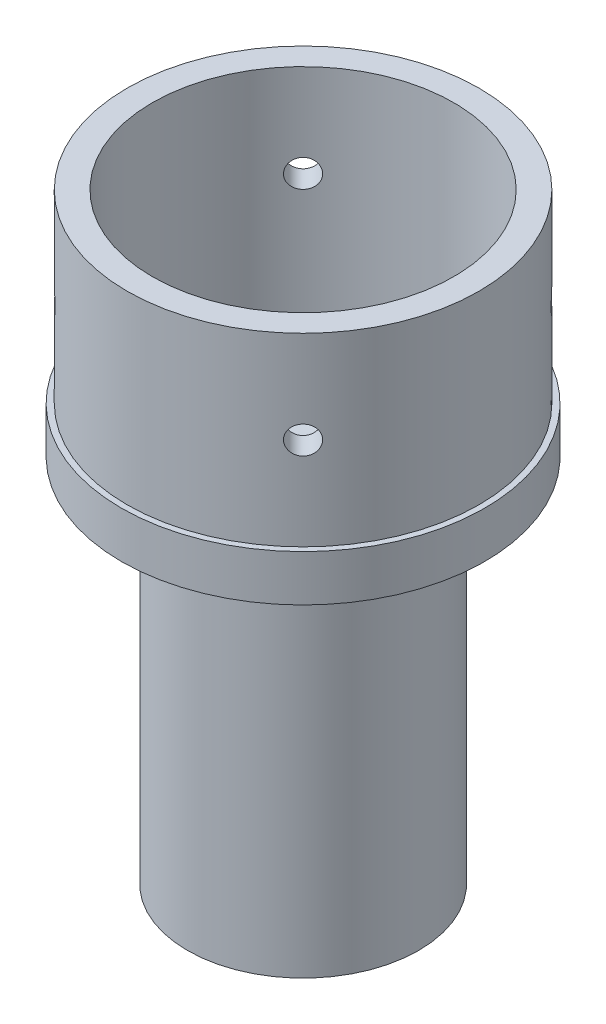
from build123d import *

# Parameters (mm, degrees)
SKETCH2_R                 = 25
SKETCH2_R_2               = 19
BOSS_EXTRUDE1_DEPTH       = 70
BOSS_EXTRUDE2_START       = 10
SKETCH3_R                 = 38.05
SKETCH3_R_2               = 32.6
BOSS_EXTRUDE2_DEPTH       = 50
BOSS_EXTRUDE3_START       = -50
BOSS_EXTRUDE3_OUTLINE_R   = 39.3
BOSS_EXTRUDE3_OUTLINE_R_2 = 38.05
BOSS_EXTRUDE3_DEPTH       = 10
CUT_EXTRUDE1_REACH        = 162.207
CUT_EXTRUDE1_END_RADIUS   = 32.6
SKETCH7_R                 = 3
CIRPATTERN1_COUNT         = 4


with BuildPart() as part:
    # Sketch2 → Boss-Extrude1 (new body)
    with BuildSketch(Plane(origin=(0, 0, 0), x_dir=(1, 0, 0), z_dir=(0, 1, 0))):
        with Locations(Location((0, 0, 0), (0, 0, 270))):
            Circle(SKETCH2_R)
        with Locations(Location((0, 0, 0), (0, 0, 270))):
            Circle(SKETCH2_R_2, mode=Mode.SUBTRACT)
    extrude(amount=BOSS_EXTRUDE1_DEPTH)



with BuildPart() as body_2:
    # Sketch3 → Boss-Extrude2 (new body)
    with BuildSketch(Plane(origin=(0, 70, 0), x_dir=(1, 0, 0), z_dir=(0, 1, 0)).offset(BOSS_EXTRUDE2_START)):
        with Locations(Location((0, 0, 0), (0, 0, 270))):
            Circle(SKETCH3_R)
        with Locations(Location((0, 0, 0), (0, 0, 270))):
            Circle(SKETCH3_R_2, mode=Mode.SUBTRACT)
    extrude(amount=BOSS_EXTRUDE2_DEPTH)


with BuildPart() as part_1:
    add(part.part)

    add(body_2.part)  # loft3 joins it to this body
    # loft up to a face of the part (loft3)
    loft([Face(Wire([part_1.edges().sort_by_distance((18.224215686, 70, -17.113677648))[0]])), Face(Wire([part_1.edges().sort_by_distance((-27.737256273, 80, -26.047017381))[0]]))])

    # Cut-Loft1: read off the stored shape, not the designer's step
    # Cut-Loft1: loft between two sections, ruled curve by curve
    cut_loft1_from = [
        Edge.make_bspline([(-18.095722376, 70, 5.791790025), (-6.512142325, 70, 41.983234777), (29.679302426, 70, 30.399654727), (18.095722376, 70, -5.791790025), (6.512142325, 70, -41.983234777), (-29.679302426, 70, -30.399654727), (-18.095722376, 70, 5.791790025)], [0, 0, 0, 0, 0.5, 0.5, 0.5, 1, 1, 1, 1], 3, [1, 0.333333333, 0.333333333, 1, 0.333333333, 0.333333333, 1]),
    ]
    cut_loft1_to = [
        Edge.make_bspline([(-21.296342667, 80, 24.682499651), (28.068656636, 80, 67.275184984), (70.661341969, 80, 17.910185682), (21.296342667, 80, -24.682499651), (-28.068656636, 80, -67.275184984), (-70.661341969, 80, -17.910185682), (-21.296342667, 80, 24.682499651)], [0, 0, 0, 0, 0.5, 0.5, 0.5, 1, 1, 1, 1], 3, [1, 0.333333333, 0.333333333, 1, 0.333333333, 0.333333333, 1]),
    ]
    cut_loft1 = Solid(Shell([*[Face.make_surface_from_curves(cut_loft1_from[k], cut_loft1_to[k]) for k in range(1)], Face(Wire(cut_loft1_from)), Face(Wire(cut_loft1_to))]))
    add(cut_loft1, mode=Mode.SUBTRACT)

    # Boss-Extrude3: read off the stored shape, not the designer's step
    # Boss-Extrude3 outline → Boss-Extrude3 (add)
    with BuildSketch(Plane(origin=(0, 130, 0), x_dir=(1, 0, 0), z_dir=(0, 1, 0)).offset(BOSS_EXTRUDE3_START)):
        Circle(BOSS_EXTRUDE3_OUTLINE_R)
        Circle(BOSS_EXTRUDE3_OUTLINE_R_2, mode=Mode.SUBTRACT)
    extrude(amount=BOSS_EXTRUDE3_DEPTH)

    # Cut-Extrude1: up to this cylinder (the profile starts outside it)
    cut_extrude1_end = Plane(origin=(0, 110, 0), z_dir=(0, -1, 0)) * Cylinder(CUT_EXTRUDE1_END_RADIUS, 390.614, mode=Mode.PRIVATE)
    # Sketch7 → Cut-Extrude1 (cut, up to the surface)
    with BuildSketch(Plane(origin=(-26.905413024, 0, 26.905413024), x_dir=(0, -1, 0), z_dir=(-0.7071067811865488, 0, 0.7071067811865464)), mode=Mode.PRIVATE) as cut_extrude1_sk1:
        with Locations(Location((-110, 0, 0), (0, 0, 90))):
            Circle(SKETCH7_R)
    cut_extrude1_tool1 = extrude(cut_extrude1_sk1.sketch, amount=-CUT_EXTRUDE1_REACH, mode=Mode.PRIVATE) - cut_extrude1_end
    cut_extrude1 = cut_extrude1_tool1.solids().sort_by_distance((-26.905413, 110, 26.905413))[0]
    add(cut_extrude1, mode=Mode.SUBTRACT)

    # CirPattern1: Cut-Extrude1 ×4 about axis
    cirpattern1_axis = Axis((0, 130, 0), (0, -1, 0))
    for i in range(1, CIRPATTERN1_COUNT):
        add(cut_extrude1.rotate(cirpattern1_axis, i * 360 / CIRPATTERN1_COUNT), mode=Mode.SUBTRACT)


solid = part_1.part
